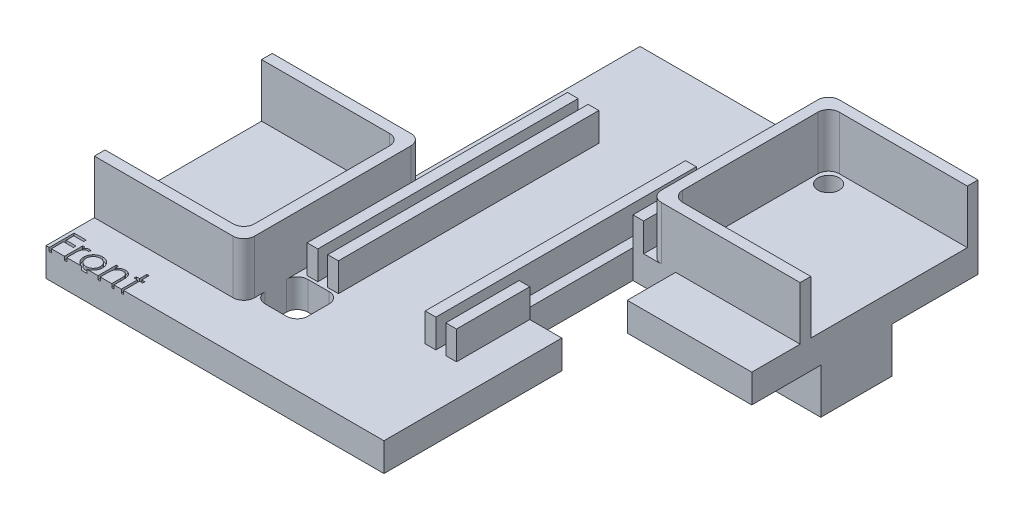
from build123d import *

# Parameters (mm, degrees)
BOSS_EXTRUDE1_DEPTH = 4
BOSS_EXTRUDE2_DEPTH = 7.5
BOSS_EXTRUDE3_DEPTH = 7.5
SKETCH6_R           = 1.5
CUT_EXTRUDE1_DEPTH  = 47.920144927
SKETCH7_W           = 1.5
SKETCH7_H           = 36.6
BOSS_EXTRUDE4_DEPTH = 4
SKETCH8_W           = 6
SKETCH8_H           = 16
CUT_EXTRUDE2_DEPTH  = 48.002659499
SKETCH12_W          = 10
SKETCH12_H          = 10
BOSS_EXTRUDE5_DEPTH = 6.35
CUT_EXTRUDE3_DEPTH  = 48.459166659
CUT_EXTRUDE4_DEPTH  = 0.5


with BuildPart() as part:
    # Sketch1 → Boss-Extrude1 (new body)
    with BuildSketch(Plane(origin=(0, 0, 0), x_dir=(1, 0, 0), z_dir=(0, 1, 0))):
        Polygon((-15, 33), (32.5, 33), (32.5, 1.2), (15, 1.2), (15, -33), (-32.5, -33), (-32.5, -1.2), (-15, -1.2), align=None)
    extrude(amount=BOSS_EXTRUDE1_DEPTH)

    # Sketch2 → Boss-Extrude2 (add)
    with BuildSketch(Plane(origin=(0, 4, 0), x_dir=(1, 0, 0), z_dir=(0, 1, 0))):
        with BuildLine():
            Line((32.5, 31.5), (14.5, 31.5))
            ThreePointArc((14.5, 31.5), (13.439339828, 31.060660172), (13, 30))
            Line((13, 30), (13, 11))
            ThreePointArc((13, 11), (13.439339828, 9.939339828), (14.5, 9.5))
            Line((14.5, 9.5), (32.5, 9.5))
            Line((32.5, 9.5), (32.5, 8))
            Line((32.5, 8), (13, 8))
            ThreePointArc((13, 8), (11.939339828, 8.439339828), (11.5, 9.5))
            Line((11.5, 9.5), (11.5, 31.5))
            ThreePointArc((11.5, 31.5), (11.939339828, 32.560660172), (13, 33))
            Line((13, 33), (32.5, 33))
            Line((32.5, 33), (32.5, 31.5))
        make_face()
    extrude(amount=BOSS_EXTRUDE2_DEPTH)

    # Sketch5 → Boss-Extrude3 (add)
    with BuildSketch(Plane(origin=(0, 4, 0), x_dir=(1, 0, 0), z_dir=(0, 1, 0))):
        with BuildLine():
            Line((-32.5, -2.7), (-14.5, -2.7))
            ThreePointArc((-14.5, -2.7), (-13.439339828, -3.139339828), (-13, -4.2))
            Line((-13, -4.2), (-13, -23.2))
            ThreePointArc((-13, -23.2), (-13.439339828, -24.260660172), (-14.5, -24.7))
            Line((-14.5, -24.7), (-32.5, -24.7))
            Line((-32.5, -24.7), (-32.5, -26.2))
            Line((-32.5, -26.2), (-13, -26.2))
            ThreePointArc((-13, -26.2), (-11.939339828, -25.760660172), (-11.5, -24.7))
            Line((-11.5, -24.7), (-11.5, -2.7))
            ThreePointArc((-11.5, -2.7), (-11.939339828, -1.639339828), (-13, -1.2))
            Line((-13, -1.2), (-32.5, -1.2))
            Line((-32.5, -1.2), (-32.5, -2.7))
        make_face()
    extrude(amount=BOSS_EXTRUDE3_DEPTH)

    # Sketch6 → Cut-Extrude1 (cut, through all)
    with BuildSketch(Plane(origin=(0, 4, 0), x_dir=(1, 0, 0), z_dir=(0, 1, 0))):
        with Locations((-15, -22.7)):
            Circle(SKETCH6_R)
        with Locations((15, 29.5)):
            Circle(SKETCH6_R)
    extrude(amount=-CUT_EXTRUDE1_DEPTH, mode=Mode.SUBTRACT)

    # Sketch7 → Boss-Extrude4 (add)
    with BuildSketch(Plane(origin=(0, 4, 0), x_dir=(1, 0, 0), z_dir=(0, 1, 0))):
        with Locations((-9.75, 0)):
            Rectangle(SKETCH7_W, SKETCH7_H)
        with Locations((-6.85, 0)):
            Rectangle(SKETCH7_W, SKETCH7_H)
        with Locations((6.85, 0)):
            Rectangle(SKETCH7_W, SKETCH7_H)
        with Locations((9.75, 0)):
            Rectangle(SKETCH7_W, SKETCH7_H)
    extrude(amount=BOSS_EXTRUDE4_DEPTH)

    # Sketch8 → Cut-Extrude2 (cut, through all)
    with BuildSketch(Plane(origin=(0, 8, 0), x_dir=(1, 0, 0), z_dir=(0, 1, 0))):
        with Locations((12, 0)):
            Rectangle(SKETCH8_W, SKETCH8_H)
    extrude(amount=-CUT_EXTRUDE2_DEPTH, mode=Mode.SUBTRACT)

    # Sketch12 → Boss-Extrude5 (add)
    with BuildSketch(Plane.XZ):
        with Locations((27.5, -15.9)):
            Rectangle(SKETCH12_W, SKETCH12_H)
        with Locations((-27.5, 18.3)):
            Rectangle(SKETCH12_W, SKETCH12_H)
    extrude(amount=BOSS_EXTRUDE5_DEPTH)

    # Sketch14 → Cut-Extrude3 (cut, through all)
    with BuildSketch(Plane(origin=(0, 4, 0), x_dir=(1, 0, 0), z_dir=(0, 1, 0))):
        with BuildLine():
            Line((-10, -18.7), (-7, -18.7))
            ThreePointArc((-7, -18.7), (-5.939339828, -19.139339828), (-5.5, -20.2))
            Line((-5.5, -20.2), (-5.5, -23.2))
            ThreePointArc((-5.5, -23.2), (-5.939339828, -24.260660172), (-7, -24.7))
            Line((-7, -24.7), (-10, -24.7))
            ThreePointArc((-10, -24.7), (-11.060660172, -24.260660172), (-11.5, -23.2))
            Line((-11.5, -23.2), (-11.5, -20.2))
            ThreePointArc((-11.5, -20.2), (-11.060660172, -19.139339828), (-10, -18.7))
        make_face()
        with BuildLine():
            Line((10, 18.7), (7, 18.7))
            ThreePointArc((7, 18.7), (5.939339828, 19.139339828), (5.5, 20.2))
            Line((5.5, 20.2), (5.5, 23.2))
            ThreePointArc((5.5, 23.2), (5.939339828, 24.260660172), (7, 24.7))
            Line((7, 24.7), (10, 24.7))
            ThreePointArc((10, 24.7), (11.060660172, 24.260660172), (11.5, 23.2))
            Line((11.5, 23.2), (11.5, 20.2))
            ThreePointArc((11.5, 20.2), (11.060660172, 19.139339828), (10, 18.7))
        make_face()
    extrude(amount=-CUT_EXTRUDE3_DEPTH, mode=Mode.SUBTRACT)

    # Sketch16 → Cut-Extrude4 (cut)
    # profile 1 of 5: a face of its own
    with BuildSketch(Plane(origin=(0, 4, 0), x_dir=(1, 0, 0), z_dir=(0, 1, 0))):
        Polygon((-32.051282051, -29.5), (-30.346153846, -29.5), (-30.346153846, -29.858974359), (-31.737179487, -29.858974359), (-31.737179487, -30.935897436), (-30.346153846, -30.935897436), (-30.346153846, -31.294871795), (-31.737179487, -31.294871795), (-31.737179487, -33), (-32.051282051, -33), align=None)
    # profile 2 of 5: a face of its own
    with BuildSketch(Plane(origin=(0, 4, 0), x_dir=(1, 0, 0), z_dir=(0, 1, 0))):
        with BuildLine():
            Line((-29.897435897, -30.442307692), (-29.583333333, -30.442307692))
            Line((-29.583333333, -30.442307692), (-29.583333333, -30.818810096))
            add(Edge.make_bspline(
                [(-29.583333333, -30.818810096), (-29.560144575, -30.783754268), (-29.515796254, -30.716710269), (-29.442083324, -30.628040968), (-29.366579993, -30.554625921), (-29.288924806, -30.496122402), (-29.208546706, -30.452309283), (-29.127209754, -30.420216248), (-29.043634284, -30.401238933), (-28.98747236, -30.398705274), (-28.959334936, -30.397435897)],
                knots=[0, 0, 0, 0, 1.2804753, 2.448899062, 3.506932113, 4.484331642, 5.4025378, 6.288909075, 7.142734305, 8, 8, 8, 8], degree=3))
            add(Edge.make_bspline(
                [(-28.959334936, -30.397435897), (-28.937508609, -30.398626424), (-28.892599524, -30.40107601), (-28.824616934, -30.418286835), (-28.754573482, -30.445764857), (-28.709431095, -30.47160508), (-28.685897436, -30.485076122)],
                knots=[0, 0, 0, 0, 0.901110191, 1.854092781, 2.881294221, 4, 4, 4, 4], degree=3))
            Line((-28.685897436, -30.485076122), (-28.858373397, -30.757111378))
            add(Edge.make_bspline(
                [(-28.858373397, -30.757111378), (-28.873482419, -30.750371112), (-28.902162233, -30.737576797), (-28.944116799, -30.722434787), (-28.982798136, -30.713518871), (-29.007441694, -30.712168153), (-29.018930288, -30.711538462)],
                knots=[0, 0, 0, 0, 1.180555205, 2.24091978, 3.179933427, 4, 4, 4, 4], degree=3))
            add(Edge.make_bspline(
                [(-29.018930288, -30.711538462), (-29.044136022, -30.713218499), (-29.095548412, -30.716645288), (-29.171032911, -30.743584096), (-29.244280117, -30.787109336), (-29.302451779, -30.835380448), (-29.347494032, -30.881928245), (-29.379634258, -30.922576648), (-29.409117005, -30.968155279), (-29.437287225, -31.017884963), (-29.462953519, -31.072614809), (-29.486908188, -31.131798023), (-29.508567051, -31.195503151), (-29.520917296, -31.239885672), (-29.52724359, -31.262620192)],
                knots=[0, 0, 0, 0, 1.125678352, 2.296057538, 3.5422874, 4.923748041, 5.663163013, 6.437101912, 7.23742474, 8.08941207, 8.991984279, 9.93940061, 10.944477711, 12, 12, 12, 12], degree=3))
            add(Edge.make_bspline(
                [(-29.52724359, -31.262620192), (-29.531975983, -31.282897366), (-29.542457875, -31.327809765), (-29.552649413, -31.403158289), (-29.562718931, -31.492181948), (-29.569815549, -31.595128541), (-29.576393591, -31.711740985), (-29.580103673, -31.84219693), (-29.583206814, -31.986630282), (-29.583289881, -32.087604635), (-29.583333333, -32.140424679)],
                knots=[0, 0, 0, 0, 0.566838948, 1.255505196, 2.06880316, 3.007127437, 4.065329342, 5.249902469, 6.561414163, 8, 8, 8, 8], degree=3))
            Line((-29.583333333, -32.140424679), (-29.583333333, -33))
            Line((-29.583333333, -33), (-29.897435897, -33))
            Line((-29.897435897, -33), (-29.897435897, -30.442307692))
        make_face()
    # profile 3 of 5: a face of its own
    with BuildSketch(Plane(origin=(0, 4, 0), x_dir=(1, 0, 0), z_dir=(0, 1, 0))):
        with BuildLine():
            add(Edge.make_bspline(
                [(-27.136418269, -30.397435897), (-27.088426996, -30.398457789), (-26.994327839, -30.400461467), (-26.856519953, -30.421876433), (-26.724974817, -30.454623797), (-26.599188625, -30.499895359), (-26.480772329, -30.56057731), (-26.368001085, -30.632986601), (-26.261184076, -30.718769195), (-26.197161047, -30.785127263), (-26.164663462, -30.818810096)],
                knots=[0, 0, 0, 0, 1.054011418, 2.066658804, 3.057071809, 4.030435133, 4.997543892, 5.974964718, 6.972108034, 8, 8, 8, 8], degree=3))
            add(Edge.make_bspline(
                [(-26.164663462, -30.818810096), (-26.136681507, -30.851024082), (-26.081259127, -30.914828624), (-26.010193408, -31.018284237), (-25.948971848, -31.125424338), (-25.899908887, -31.237671664), (-25.861223864, -31.354046336), (-25.833758167, -31.474948347), (-25.817421232, -31.600110694), (-25.815218265, -31.685114532), (-25.814102564, -31.728165064)],
                knots=[0, 0, 0, 0, 1.025258237, 2.030674902, 3.01204498, 3.988269485, 4.97094183, 5.956517959, 6.965070386, 8, 8, 8, 8], degree=3))
            add(Edge.make_bspline(
                [(-25.814102564, -31.728165064), (-25.815083901, -31.771465122), (-25.81702307, -31.857028055), (-25.835366686, -31.983047421), (-25.863897772, -32.105242244), (-25.90472961, -32.223100937), (-25.957087719, -32.336983765), (-26.020978407, -32.446393314), (-26.096850024, -32.551545447), (-26.182854021, -32.651547286), (-26.277905897, -32.7437135), (-26.381022045, -32.82404177), (-26.490176079, -32.892863294), (-26.606819432, -32.94829971), (-26.729886919, -32.99200941), (-26.859643987, -33.022709427), (-26.995889058, -33.04127111), (-27.088916279, -33.043654684), (-27.136418269, -33.044871795)],
                knots=[0, 0, 0, 0, 0.998656419, 1.973391657, 2.932242238, 3.890759089, 4.846373663, 5.82037756, 6.809684879, 7.83454468, 8.860553229, 9.859544525, 10.845671541, 11.83227036, 12.833544569, 13.85385346, 14.904124723, 16, 16, 16, 16], degree=3))
            add(Edge.make_bspline(
                [(-27.136418269, -33.044871795), (-27.184152989, -33.043650599), (-27.277643848, -33.041258824), (-27.41436983, -33.022781541), (-27.544359449, -32.992023559), (-27.667588048, -32.948156066), (-27.784732895, -32.892861522), (-27.894519392, -32.824249833), (-27.997719307, -32.743689678), (-28.092791292, -32.651553741), (-28.178789897, -32.551543784), (-28.254662905, -32.446393746), (-28.318553232, -32.336983652), (-28.370911435, -32.223100967), (-28.411743248, -32.105242236), (-28.440274341, -31.983047423), (-28.458617956, -31.857028055), (-28.460557124, -31.771465122), (-28.461538462, -31.728165064)],
                knots=[0, 0, 0, 0, 1.099876186, 2.154163076, 3.173186993, 4.173200201, 5.163417411, 6.152872554, 7.150605724, 8.17532212, 9.198891216, 10.186952605, 11.159729845, 12.11414092, 13.071450619, 14.029093627, 15.002601286, 16, 16, 16, 16], degree=3))
            add(Edge.make_bspline(
                [(-28.461538462, -31.728165064), (-28.460415151, -31.685348518), (-28.45819119, -31.600579116), (-28.441870681, -31.475652055), (-28.414512124, -31.354954666), (-28.375780728, -31.23902919), (-28.326265537, -31.127273754), (-28.265904249, -31.019868923), (-28.194113616, -30.916881123), (-28.138911665, -30.853159043), (-28.110977564, -30.820913462)],
                knots=[0, 0, 0, 0, 1.031353054, 2.041901799, 3.029428768, 4.008703097, 4.981709435, 5.96992636, 6.972712378, 8, 8, 8, 8], degree=3))
            add(Edge.make_bspline(
                [(-28.110977564, -30.820913462), (-28.078528973, -30.786938522), (-28.014713109, -30.720120826), (-27.907364381, -30.634588302), (-27.79487056, -30.560672228), (-27.675145634, -30.501196013), (-27.549462776, -30.454357495), (-27.417243534, -30.42179198), (-27.278968018, -30.400538625), (-27.184408397, -30.398480447), (-27.136418269, -30.397435897)],
                knots=[0, 0, 0, 0, 1.027980169, 2.021703884, 2.998553061, 3.971491411, 4.943284454, 5.930300938, 6.949603206, 8, 8, 8, 8], degree=3))
        make_face()
        with BuildLine():
            add(Edge.make_bspline(
                [(-27.137820513, -30.711538462), (-27.171758124, -30.712503053), (-27.238757253, -30.714407336), (-27.337376838, -30.72889124), (-27.432316991, -30.751838745), (-27.523757836, -30.784442801), (-27.611391008, -30.8265417), (-27.69530041, -30.87825006), (-27.77573285, -30.938883016), (-27.851114914, -31.008345688), (-27.920297226, -31.084224683), (-27.980775202, -31.165073041), (-28.032200309, -31.249579388), (-28.075040468, -31.337831599), (-28.106947656, -31.430724013), (-28.130120678, -31.527204644), (-28.144590919, -31.62747006), (-28.146477297, -31.695631079), (-28.147435897, -31.730268429)],
                knots=[0, 0, 0, 0, 1.021534396, 2.016698045, 2.994645724, 3.958388632, 4.93408049, 5.916473867, 6.921342795, 7.962252576, 8.998418191, 10.008913653, 10.997312074, 11.973003931, 12.956656626, 13.948281152, 14.957379055, 16, 16, 16, 16], degree=3))
            add(Edge.make_bspline(
                [(-28.147435897, -31.730268429), (-28.145829074, -31.775020457), (-28.142639829, -31.863844862), (-28.116704593, -31.994655985), (-28.073318313, -32.120237837), (-28.014731033, -32.239854223), (-27.941324815, -32.350526501), (-27.854837748, -32.449197985), (-27.756198048, -32.534383797), (-27.646581547, -32.605064642), (-27.528227229, -32.661224398), (-27.402970908, -32.701023374), (-27.272330214, -32.726895066), (-27.183049483, -32.729466541), (-27.137820513, -32.730769231)],
                knots=[0, 0, 0, 0, 1.016792936, 2.018143844, 3.017858371, 4.030088057, 5.03801393, 6.028138512, 7.003788237, 7.991172063, 8.984598303, 9.972568034, 10.972917682, 12, 12, 12, 12], degree=3))
            add(Edge.make_bspline(
                [(-27.137820513, -32.730769231), (-27.092594144, -32.729458951), (-27.003318548, -32.726872494), (-26.872859371, -32.701153674), (-26.747945399, -32.661050013), (-26.629714012, -32.605127803), (-26.520147408, -32.534115389), (-26.420798287, -32.449679012), (-26.335049676, -32.35026516), (-26.261716071, -32.239707631), (-26.202169328, -32.120423279), (-26.158986126, -31.994632807), (-26.132988541, -31.863850765), (-26.129807712, -31.775022434), (-26.128205128, -31.730268429)],
                knots=[0, 0, 0, 0, 1.02726834, 2.027799167, 3.010890988, 4.004497153, 4.992059811, 5.971914811, 6.958719428, 7.966827853, 8.981595046, 9.981490638, 10.983022906, 12, 12, 12, 12], degree=3))
            add(Edge.make_bspline(
                [(-26.128205128, -31.730268429), (-26.129163398, -31.695630872), (-26.131049127, -31.627469446), (-26.145524092, -31.527206993), (-26.168679631, -31.430715396), (-26.200651249, -31.337863393), (-26.243305262, -31.249350888), (-26.295722056, -31.165321161), (-26.355953081, -31.083944615), (-26.425970202, -31.008590974), (-26.50127358, -30.938855938), (-26.581738618, -30.878226548), (-26.665523597, -30.826768953), (-26.752902179, -30.784082712), (-26.844354747, -30.752135372), (-26.939161876, -30.728758741), (-27.037360686, -30.714468544), (-27.104119729, -30.712521402), (-27.137820513, -30.711538462)],
                knots=[0, 0, 0, 0, 1.042956736, 2.052379634, 3.044323526, 4.02829302, 5.004299113, 5.996692471, 7.007513377, 8.048758398, 9.090003419, 10.095195979, 11.07790575, 12.047570684, 13.018257071, 13.989683339, 14.985167495, 16, 16, 16, 16], degree=3))
        make_face(mode=Mode.SUBTRACT)
    # profile 4 of 5: a face of its own
    with BuildSketch(Plane(origin=(0, 4, 0), x_dir=(1, 0, 0), z_dir=(0, 1, 0))):
        with BuildLine():
            Line((-25.185897436, -30.442307692), (-24.871794872, -30.442307692))
            Line((-24.871794872, -30.442307692), (-24.871794872, -30.903645833))
            add(Edge.make_bspline(
                [(-24.871794872, -30.903645833), (-24.838257237, -30.86180311), (-24.773176286, -30.780605847), (-24.664791952, -30.673885272), (-24.550248052, -30.585940047), (-24.430246049, -30.515836253), (-24.304623038, -30.462989627), (-24.174144768, -30.424823696), (-24.038030062, -30.401938868), (-23.945465626, -30.398948637), (-23.898637821, -30.397435897)],
                knots=[0, 0, 0, 0, 1.12780773, 2.188550248, 3.19190651, 4.159438251, 5.104880172, 6.052711206, 7.014878035, 8, 8, 8, 8], degree=3))
            add(Edge.make_bspline(
                [(-23.898637821, -30.397435897), (-23.851307186, -30.399181093), (-23.758669719, -30.402596861), (-23.623791657, -30.429613552), (-23.497818264, -30.475758808), (-23.381198708, -30.538970878), (-23.276071494, -30.617577351), (-23.183746643, -30.709155133), (-23.107383396, -30.814491216), (-23.056186033, -30.912214373), (-23.022460385, -30.998903167), (-23.001228047, -31.073149917), (-22.983197066, -31.155868068), (-22.967565318, -31.246807657), (-22.956988206, -31.346605847), (-22.948645914, -31.454853539), (-22.94266722, -31.57151567), (-22.942430013, -31.652202297), (-22.942307692, -31.693810096)],
                knots=[0, 0, 0, 0, 1.235846778, 2.418850247, 3.575807741, 4.728682307, 5.871620074, 6.994088408, 8.11269785, 9.256955736, 9.865816715, 10.540099792, 11.271859618, 12.076849838, 12.949306005, 13.892391288, 14.913166135, 16, 16, 16, 16], degree=3))
            Line((-22.942307692, -31.693810096), (-22.942307692, -33))
            Line((-22.942307692, -33), (-23.256410256, -33))
            Line((-23.256410256, -33), (-23.256410256, -31.796875))
            add(Edge.make_bspline(
                [(-23.256410256, -31.796875), (-23.256603464, -31.762052555), (-23.256973038, -31.695443144), (-23.258138685, -31.600074121), (-23.260948492, -31.513587543), (-23.264896805, -31.436190175), (-23.270675835, -31.367956339), (-23.276698467, -31.308747062), (-23.284063443, -31.25863752), (-23.290626357, -31.228472437), (-23.293569712, -31.21494391)],
                knots=[0, 0, 0, 0, 1.430800155, 2.736877192, 3.918605307, 4.986035426, 5.920637409, 6.731861385, 7.431261377, 8, 8, 8, 8], degree=3))
            add(Edge.make_bspline(
                [(-23.293569712, -31.21494391), (-23.304195243, -31.175232725), (-23.324646104, -31.098800981), (-23.375180087, -30.995126628), (-23.438994268, -30.90692844), (-23.516892117, -30.834751719), (-23.608121193, -30.778580882), (-23.712428335, -30.739606927), (-23.828806976, -30.715230658), (-23.910661359, -30.712803526), (-23.953325321, -30.711538462)],
                knots=[0, 0, 0, 0, 1.084156227, 2.086665306, 3.027808233, 3.945421172, 4.874247719, 5.839848303, 6.874090471, 8, 8, 8, 8], degree=3))
            add(Edge.make_bspline(
                [(-23.953325321, -30.711538462), (-23.978593004, -30.712014466), (-24.028597097, -30.712956467), (-24.102747069, -30.722407765), (-24.174671242, -30.737866221), (-24.245091451, -30.758734858), (-24.312599245, -30.787397127), (-24.379363536, -30.819926498), (-24.4428703, -30.86047471), (-24.504473697, -30.905665331), (-24.561786505, -30.955744538), (-24.615114843, -31.008589048), (-24.662652864, -31.064864652), (-24.705721539, -31.1236646), (-24.742899802, -31.185796438), (-24.77535289, -31.250660744), (-24.802888585, -31.318342893), (-24.816571278, -31.365317954), (-24.823417468, -31.388822115)],
                knots=[0, 0, 0, 0, 1.023777757, 2.026029729, 3.023749952, 4.003683103, 4.997618607, 5.993177895, 7.010360494, 8.046726602, 9.087585522, 10.09234134, 11.086953743, 12.070360549, 13.043493632, 14.017870808, 15.008233677, 16, 16, 16, 16], degree=3))
            add(Edge.make_bspline(
                [(-24.823417468, -31.388822115), (-24.827357117, -31.406077318), (-24.835933525, -31.443640993), (-24.845196705, -31.505285412), (-24.853604281, -31.576595387), (-24.860641239, -31.657487704), (-24.864946656, -31.748245579), (-24.869641053, -31.848481417), (-24.871350114, -31.958594906), (-24.871642468, -32.035256598), (-24.871794872, -32.075220353)],
                knots=[0, 0, 0, 0, 0.615963638, 1.340920617, 2.168419149, 3.115676021, 4.16674242, 5.331190069, 6.6087489, 8, 8, 8, 8], degree=3))
            Line((-24.871794872, -32.075220353), (-24.871794872, -33))
            Line((-24.871794872, -33), (-25.185897436, -33))
            Line((-25.185897436, -33), (-25.185897436, -30.442307692))
        make_face()
    # profile 5 of 5: a face of its own
    with BuildSketch(Plane(origin=(0, 4, 0), x_dir=(1, 0, 0), z_dir=(0, 1, 0))):
        Polygon((-21.91025641, -29.41025641), (-21.596153846, -29.41025641), (-21.596153846, -30.442307692), (-21.147435897, -30.442307692), (-21.147435897, -30.756410256), (-21.596153846, -30.756410256), (-21.596153846, -33), (-21.91025641, -33), (-21.91025641, -30.756410256), (-22.358974359, -30.756410256), (-22.358974359, -30.442307692), (-21.91025641, -30.442307692), align=None)
    extrude(amount=-CUT_EXTRUDE4_DEPTH, mode=Mode.SUBTRACT)


solid = part.part
